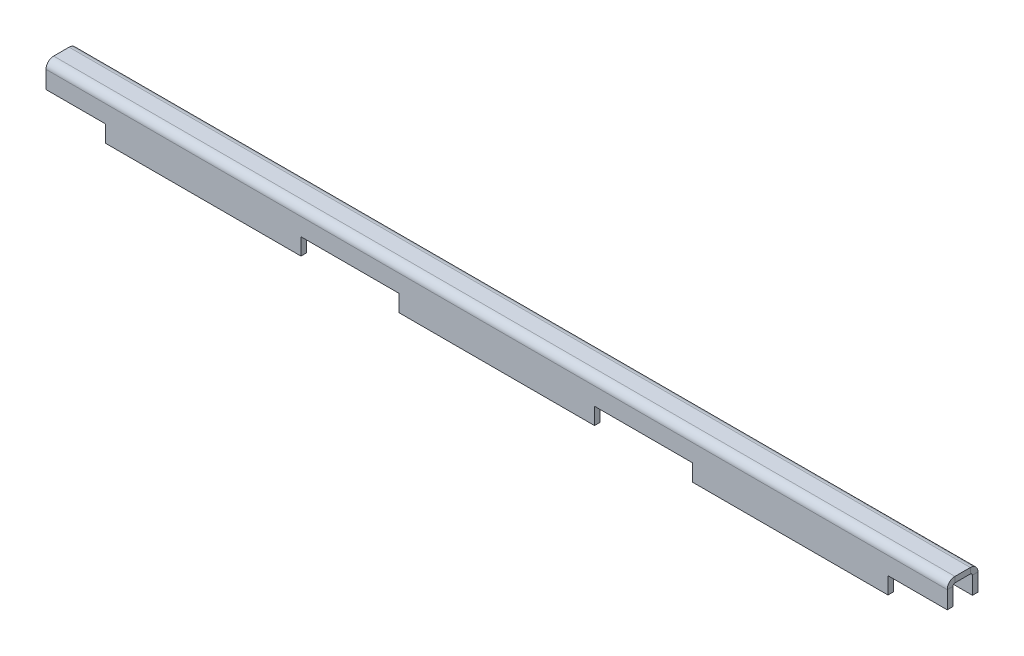
from build123d import *

# Parameters (mm, degrees)
SKETCH2_W                      = 322.4
SKETCH2_H                      = 11
BASE_FLANGE1_DEPTH             = 2
EDGE_FLANGE1_STRIP_W           = 9.4732
EDGE_FLANGE1_STRIP_H           = 2
EDGE_FLANGE1_STRIP_CUT_DEPTH   = 322.4
EDGE_FLANGE1_STRIP_2_W         = 9.4732
EDGE_FLANGE1_STRIP_2_H         = 2
EDGE_FLANGE1_STRIP_CUT_2_DEPTH = 322.4
EDGE_FLANGE1_DEPTH             = 322.4
EDGE_FLANGE1_BEND_DEPTH        = 322.4
SKETCH15_W                     = 70
SKETCH15_H                     = 6
TAB1_DEPTH                     = 2


# Sheet-metal steps are written as plain solids
with BuildPart() as part:
    # Sketch2 → Base-Flange1 (new body)
    with BuildSketch(Plane(origin=(0, 0, 0), x_dir=(1, 0, 0), z_dir=(0, 1, 0))):
        Rectangle(SKETCH2_W, SKETCH2_H)
    extrude(amount=-BASE_FLANGE1_DEPTH)

    # Edge-Flange1 strip (across the edge) → Edge-Flange1 strip cut (cut)
    with BuildSketch(Plane(origin=(161.2, -2, 5.5), x_dir=(0, 0, -1), z_dir=(-1, 0, 0))):
        with Locations((-2, -1)):
            Rectangle(EDGE_FLANGE1_STRIP_W, EDGE_FLANGE1_STRIP_H)
    extrude(amount=EDGE_FLANGE1_STRIP_CUT_DEPTH, mode=Mode.SUBTRACT)

    # Edge-Flange1 strip 2 (across the edge) → Edge-Flange1 strip cut 2 (cut)
    with BuildSketch(Plane(origin=(-161.2, -2, -5.5), x_dir=(0, 0, 1), z_dir=(1, 0, 0))):
        with Locations((-2, -1)):
            Rectangle(EDGE_FLANGE1_STRIP_2_W, EDGE_FLANGE1_STRIP_2_H)
    extrude(amount=EDGE_FLANGE1_STRIP_CUT_2_DEPTH, mode=Mode.SUBTRACT)

    # Edge-Flange1 section (across the edge) → Edge-Flange1 (add)
    with BuildSketch(Plane(origin=(161.2, -2, 5.5), x_dir=(0, 0, -1), z_dir=(-1, 0, 0))):
        with BuildLine():
            Line((0, 0.7366), (0, 7))
            Line((0, 7), (2, 7))
            Line((2, 7), (2, 0.7366))
            ThreePointArc((2, 0.7366), (2.215745145, 0.215745145), (2.7366, 0))
            Line((2.7366, 0), (2.7366, -2))
            ThreePointArc((2.7366, -2), (0.801531583, -1.198468417), (0, 0.7366))
        make_face()
    extrude(amount=EDGE_FLANGE1_DEPTH)

    # Edge-Flange1 section 2 (across the edge) → Edge-Flange1 bend (add)
    with BuildSketch(Plane(origin=(-161.2, -2, -5.5), x_dir=(0, 0, 1), z_dir=(1, 0, 0))):
        with BuildLine():
            Line((0, 0.7366), (0, 7))
            Line((0, 7), (2, 7))
            Line((2, 7), (2, 0.7366))
            ThreePointArc((2, 0.7366), (2.215745145, 0.215745145), (2.7366, 0))
            Line((2.7366, 0), (2.7366, -2))
            ThreePointArc((2.7366, -2), (0.801531583, -1.198468417), (0, 0.7366))
        make_face()
    extrude(amount=EDGE_FLANGE1_BEND_DEPTH)

    # Sketch15 → Tab1 (add)
    with BuildSketch(Plane(origin=(0, 0, -5.5), x_dir=(-1, 0, 0), z_dir=(0, 0, -1))):
        with Locations((-105, -12)):
            Rectangle(SKETCH15_W, SKETCH15_H)
        with Locations((0, -12)):
            Rectangle(SKETCH15_W, SKETCH15_H)
        with Locations((105, -12)):
            Rectangle(SKETCH15_W, SKETCH15_H)
    tab1 = extrude(amount=-TAB1_DEPTH)

    # Mirror1: Tab1 across plane
    add(tab1.mirror(Plane.XY))


solid = part.part
